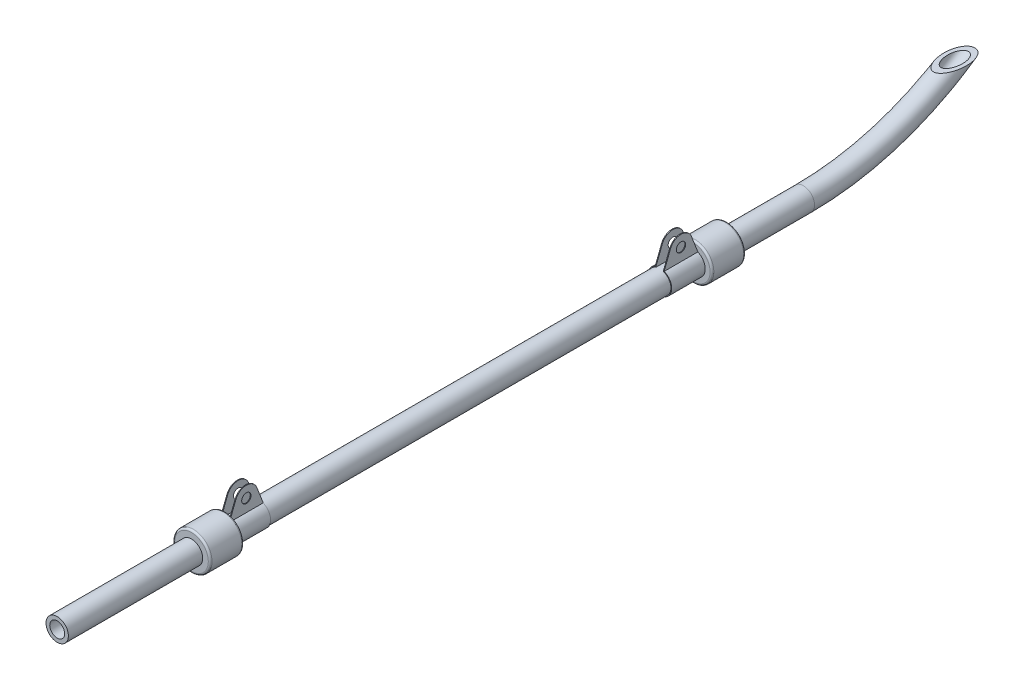
from build123d import *

# Parameters (mm, degrees)
BARRER_L_MINA1_PROFILE_R    = 3
BARRER_L_MINA1_PROFILE_R_2  = 2
BARRER_L_MINA2_PROFILE_R    = 3
BARRER_L_MINA2_PROFILE_R_2  = 2
CORTAR_EXTRUIR1_DEPTH       = 276.631598791
CORTAR_EXTRUIR1_DEPTH_BACK  = 276.631598791
CROQUIS31_OUTSIDE_W         = 328.895
CROQUIS31_OUTSIDE_H         = 106.795
CROQUIS31_OUTSIDE_W_2       = 245.98912915
CROQUIS31_OUTSIDE_H_2       = 15
CROQUIS34_W                 = 0.2
CROQUIS34_H                 = 9
CORTAR_EXTRUIR2_START       = -7.171572875
CORTAR_EXTRUIR2_OUTLINE_W   = 2
CORTAR_EXTRUIR2_OUTLINE_H   = 9
CORTAR_EXTRUIR2_DEPTH       = 0.371572875
CORTAR_EXTRUIR2_2_OUTLINE_W = 2
CORTAR_EXTRUIR2_2_OUTLINE_H = 9
CORTAR_EXTRUIR2_2_DEPTH     = 0.371572875
CROQUIS37_R                 = 1.25
SALIENTE_EXTRUIR3_DEPTH     = 0.2
SALIENTE_EXTRUIR3_2_DEPTH   = 0.2


# Read off the part's stored shape, not the designer's step: Cortar-Extruir2
with BuildPart() as part:
    # Barrer-Lámina1: sweep along a path in Croquis1
    with BuildLine(Plane(origin=(0, 0, 0), x_dir=(0, 0, -1), z_dir=(1, 0, 0))) as barrer_l_mina1_path:
        Line((0, 0), (200, 0))
    # Barrer-Lámina1 profile (on start of the path) → Barrer-Lámina1 (sweep)
    with BuildSketch(Plane(origin=(0, 0, 0), x_dir=(-1, 0, 0), z_dir=(0, 0, -1))):
        Circle(BARRER_L_MINA1_PROFILE_R)
        Circle(BARRER_L_MINA1_PROFILE_R_2, mode=Mode.SUBTRACT)
    sweep(path=barrer_l_mina1_path.line)

    # Barrer-Lámina2: sweep along a path in Croquis18
    with BuildLine(Plane(origin=(0, 0, 0), x_dir=(0, 0, -1), z_dir=(1, 0, 0))) as barrer_l_mina2_path:
        ThreePointArc((200, 0), (241.247743029, 12.361164642), (268.89894892, 45.3700348))
    # Barrer-Lámina2 profile (on start of the path) → Barrer-Lámina2 (sweep)
    with BuildSketch(Plane(origin=(0, 0, -200), x_dir=(-1, 0, 0), z_dir=(0, 0, -1))):
        Circle(BARRER_L_MINA2_PROFILE_R)
        Circle(BARRER_L_MINA2_PROFILE_R_2, mode=Mode.SUBTRACT)
    sweep(path=barrer_l_mina2_path.line)

    # Croquis31 outside → Cortar-Extruir1 (cut, two sides: drawn at the far end of the back side and taken through both)
    with BuildSketch(Plane(origin=(0, 0, 0), x_dir=(0, 0, -1), z_dir=(1, 0, 0)).offset(-CORTAR_EXTRUIR1_DEPTH_BACK)):
        with Locations((135.8275, 21.7775)):
            Rectangle(CROQUIS31_OUTSIDE_W, CROQUIS31_OUTSIDE_H)
        with Locations((122.994564575, 4.5)):
            Rectangle(CROQUIS31_OUTSIDE_W_2, CROQUIS31_OUTSIDE_H_2, mode=Mode.SUBTRACT)
    extrude(amount=CORTAR_EXTRUIR1_DEPTH + CORTAR_EXTRUIR1_DEPTH_BACK, mode=Mode.SUBTRACT)


with BuildPart() as body_2:
    # Croquis33 → Revolución1 (revolve)
    with BuildSketch(Plane(origin=(0, 0, 0), x_dir=(0, 0, -1), z_dir=(1, 0, 0)), mode=Mode.PRIVATE) as revoluci_n1_sk:
        with BuildLine():
            ThreePointArc((36, 4.5), (36.146446609, 4.853553391), (36.5, 5))
            Line((36.5, 5), (44.5, 5))
            ThreePointArc((44.5, 5), (44.853553391, 4.853553391), (45, 4.5))
            Line((45, 4.5), (45, 3))
            Line((45, 3), (36, 3))
            Line((36, 3), (36, 4.5))
        make_face()
        with BuildLine():
            ThreePointArc((170.5, 4.5), (170.646446609, 4.853553391), (171, 5))
            Line((171, 5), (179, 5))
            ThreePointArc((179, 5), (179.353553391, 4.853553391), (179.5, 4.5))
            Line((179.5, 4.5), (179.5, 3))
            Line((179.5, 3), (170.5, 3))
            Line((170.5, 3), (170.5, 4.5))
        make_face()
    revolve(revoluci_n1_sk.sketch.rotate(Axis((0, 0, 0), (0, 0, -1)), 90), axis=Axis((0, 0, 0), (0, 0, -1)))


with BuildPart() as body_3:
    # Croquis34 → Revolución2 (revolve)
    with BuildSketch(Plane(origin=(0, 0, 0), x_dir=(1, 0, 0), z_dir=(0, 1, 0)), mode=Mode.PRIVATE) as revoluci_n2_sk:
        with Locations((-3.1, 166)):
            Rectangle(CROQUIS34_W, CROQUIS34_H)
        with Locations((-3.1, 49.5)):
            Rectangle(CROQUIS34_W, CROQUIS34_H)
    revolve(revoluci_n2_sk.sketch.rotate(Axis((0, 0, 0), (0, 0, -1)), 180), axis=Axis((0, 0, 0), (0, 0, -1)))

    # Cortar-Extruir2 outline → Cortar-Extruir2 (cut)
    with BuildSketch(Plane(origin=(0, 10, 0), x_dir=(1, 0, 0), z_dir=(0, 1, 0)).offset(CORTAR_EXTRUIR2_START)):
        with Locations((0, 166)):
            Rectangle(CORTAR_EXTRUIR2_OUTLINE_W, CORTAR_EXTRUIR2_OUTLINE_H)
    extrude(amount=CORTAR_EXTRUIR2_DEPTH, mode=Mode.SUBTRACT)

    # Cortar-Extruir2 2 outline → Cortar-Extruir2 2 (cut)
    with BuildSketch(Plane(origin=(0, 10, 0), x_dir=(1, 0, 0), z_dir=(0, 1, 0)).offset(CORTAR_EXTRUIR2_START)):
        with Locations((0, 49.5)):
            Rectangle(CORTAR_EXTRUIR2_2_OUTLINE_W, CORTAR_EXTRUIR2_2_OUTLINE_H)
    extrude(amount=CORTAR_EXTRUIR2_2_DEPTH, mode=Mode.SUBTRACT)


with BuildPart() as body_4:
    # Croquis37 → Saliente-Extruir3 (new body)
    with BuildSketch(Plane(origin=(-1, 0, 0), x_dir=(0, 0, -1), z_dir=(1, 0, 0))):
        with BuildLine():
            Line((170.5, 2.828427125), (161.5, 2.828427125))
            Line((161.5, 2.828427125), (161.5, 3.039736831))
            Line((161.5, 3.039736831), (163.204460271, 7.416984714))
            ThreePointArc((163.204460271, 7.416984714), (166, 9.328427125), (168.795539729, 7.416984714))
            Line((168.795539729, 7.416984714), (170.5, 3.039736831))
            Line((170.5, 3.039736831), (170.5, 2.828427125))
        make_face()
        with Locations((166, 6.328427125)):
            Circle(CROQUIS37_R, mode=Mode.SUBTRACT)
    saliente_extruir3 = extrude(amount=-SALIENTE_EXTRUIR3_DEPTH)


with BuildPart() as body_5:
    # Croquis37 → Saliente-Extruir3 2 (new body)
    with BuildSketch(Plane(origin=(-1, 0, 0), x_dir=(0, 0, -1), z_dir=(1, 0, 0))):
        with BuildLine():
            Line((45, 3.039736831), (46.704460271, 7.416984714))
            ThreePointArc((46.704460271, 7.416984714), (49.5, 9.328427125), (52.295539729, 7.416984714))
            Line((52.295539729, 7.416984714), (54, 3.039736831))
            Line((54, 3.039736831), (54, 2.828427125))
            Line((54, 2.828427125), (45, 2.828427125))
            Line((45, 2.828427125), (45, 3.039736831))
        make_face()
        with Locations((49.5, 6.328427125)):
            Circle(CROQUIS37_R, mode=Mode.SUBTRACT)
    saliente_extruir3_2 = extrude(amount=-SALIENTE_EXTRUIR3_2_DEPTH)


with BuildPart() as body_3_1:
    add(body_3.part)

    # Simetría2: Saliente-Extruir3, Saliente-Extruir3 2 across plane
    add(saliente_extruir3.mirror(Plane(origin=(0, 0, 0), x_dir=(0, 0, 1), z_dir=(1, 0, 0))))
    add(saliente_extruir3_2.mirror(Plane(origin=(0, 0, 0), x_dir=(0, 0, 1), z_dir=(1, 0, 0))))


with BuildPart() as body_5_1:
    add(body_5.part)

    # Combinar1: union body 3
    add(body_3_1.part)


with BuildPart() as body_4_1:
    add(body_4.part)

    # Combinar2: union body 5
    add(body_5_1.part)


solid = Compound([part.part, body_2.part, body_4_1.part])
